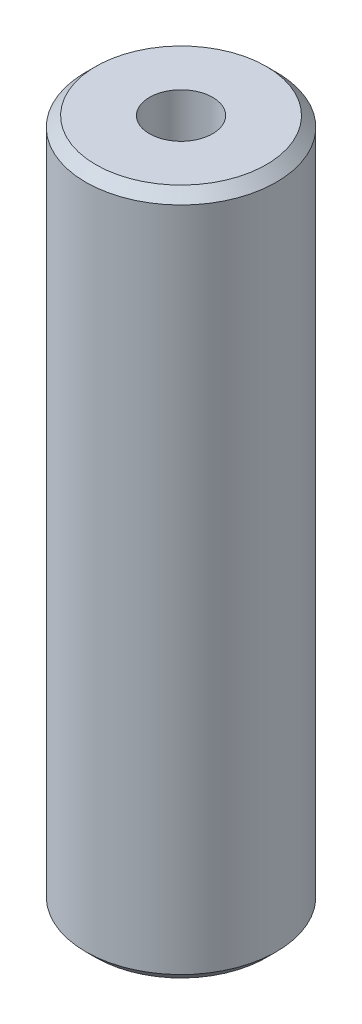
from build123d import *

# Parameters (mm, degrees)
SKETCH1_R           = 15
BOSS_EXTRUDE1_DEPTH = 108.071181791
SKETCH2_R           = 4.971449022
CUT_EXTRUDE1_DEPTH  = 111.133466002
CHAMFER1_SIZE       = 1.591252279


with BuildPart() as part:
    # Sketch1 → Boss-Extrude1 (new body)
    with BuildSketch(Plane(origin=(0, 0, 0), x_dir=(1, 0, 0), z_dir=(0, 1, 0))):
        Circle(SKETCH1_R)
    extrude(amount=BOSS_EXTRUDE1_DEPTH)

    # Sketch2 → Cut-Extrude1 (cut, through all)
    with BuildSketch(Plane(origin=(0, 0, 0), x_dir=(1, 0, 0), z_dir=(0, 1, 0))):
        Circle(SKETCH2_R)
    extrude(amount=CUT_EXTRUDE1_DEPTH, mode=Mode.SUBTRACT)

    # Chamfer1
    chamfer1_edges = [part.edges().sort_by_distance(p)[0] for p in [
        (-15, 108.071181791, 0),
        (-15, 0, 0),
    ]]
    chamfer(chamfer1_edges, length=CHAMFER1_SIZE)


solid = part.part
